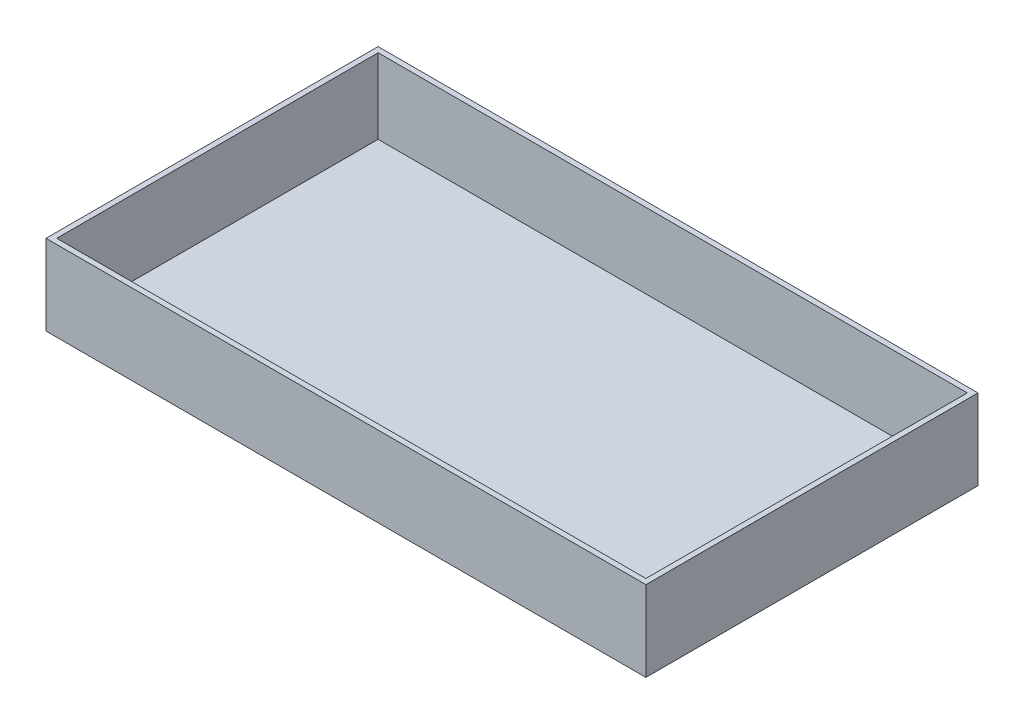
from build123d import *

# Parameters (mm, degrees)
SKETCH_1_W      = 560
SKETCH_1_H      = 310
EXTRUDE_1_DEPTH = 75
SHELL_1_T       = -5


with BuildPart() as part:
    # ｽｹｯﾁ1 → ﾎﾞｽ - 押し出し1 (new body)
    with BuildSketch(Plane(origin=(0, 0, 0), x_dir=(1, 0, 0), z_dir=(0, 1, 0))):
        Rectangle(SKETCH_1_W, SKETCH_1_H)
    extrude(amount=EXTRUDE_1_DEPTH)

    # ｼｪﾙ1
    shell_1_openings = [part.faces().sort_by_distance(p)[0] for p in [
        (0, 75, 0),
    ]]
    offset(amount=SHELL_1_T, openings=shell_1_openings, kind=Kind.INTERSECTION)


solid = part.part
